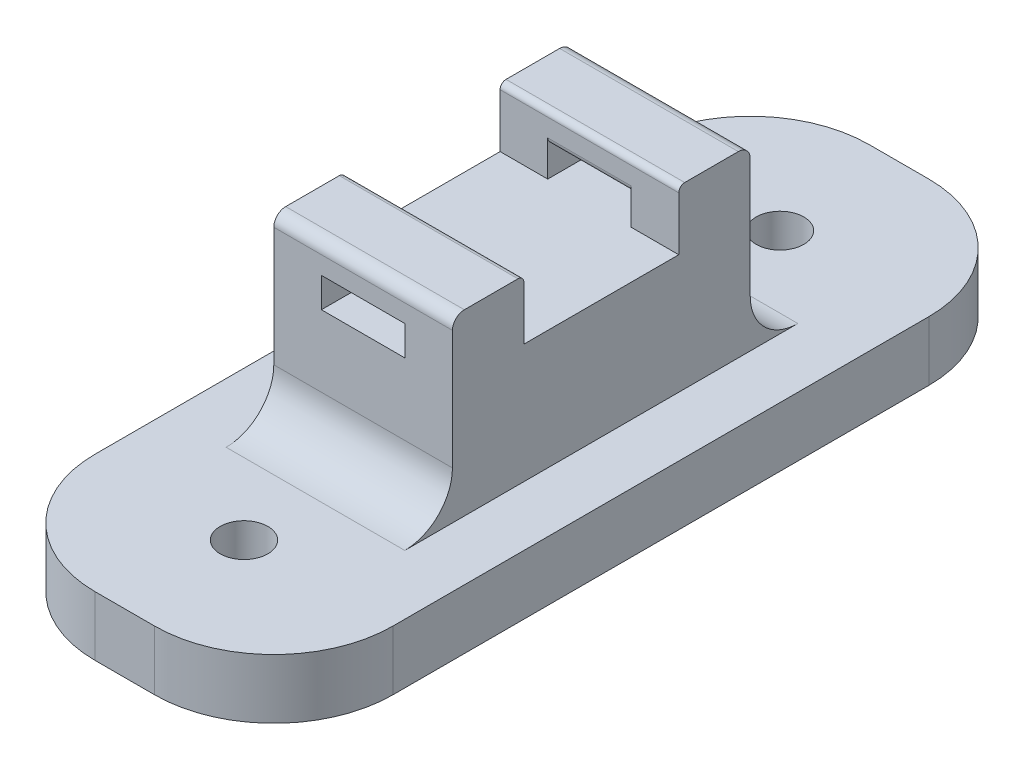
from build123d import *

# Parameters (mm, degrees)
SKETCH1_W           = 25
SKETCH1_H           = 65
BOSS_EXTRUDE1_DEPTH = 5
SKETCH2_R           = 2
CUT_EXTRUDE1_DEPTH  = 70.821200219
SKETCH3_W           = 15
SKETCH3_H           = 25
BOSS_EXTRUDE2_DEPTH = 10
SKETCH4_W           = 15
SKETCH4_H           = 6
BOSS_EXTRUDE3_DEPTH = 5
SKETCH5_W           = 7
SKETCH5_H           = 2.5
CUT_EXTRUDE2_DEPTH  = 56.226805086
FILLET1_R           = 0.5
FILLET2_R           = 0.5
FILLET3_R           = 1
FILLET4_R           = 10
FILLET5_R           = 4


with BuildPart() as part:
    # Sketch1 → Boss-Extrude1 (new body)
    with BuildSketch(Plane(origin=(0, 0, 0), x_dir=(1, 0, 0), z_dir=(0, 1, 0))):
        with Locations((12.5, 32.5)):
            Rectangle(SKETCH1_W, SKETCH1_H)
    extrude(amount=BOSS_EXTRUDE1_DEPTH)

    # Sketch2 → Cut-Extrude1 (cut, through all)
    with BuildSketch(Plane(origin=(0, 0, 0), x_dir=(1, 0, 0), z_dir=(0, 1, 0))):
        with Locations((12.5, 55)):
            Circle(SKETCH2_R)
        with Locations((12.5, 10)):
            Circle(SKETCH2_R)
    extrude(amount=CUT_EXTRUDE1_DEPTH, mode=Mode.SUBTRACT)

    # Sketch3 → Boss-Extrude2 (add)
    with BuildSketch(Plane(origin=(0, 5, 0), x_dir=(1, 0, 0), z_dir=(0, 1, 0))):
        with Locations((12.5, 32.5)):
            Rectangle(SKETCH3_W, SKETCH3_H)
    extrude(amount=BOSS_EXTRUDE2_DEPTH)

    # Sketch4 → Boss-Extrude3 (add)
    with BuildSketch(Plane(origin=(0, 15, 0), x_dir=(1, 0, 0), z_dir=(0, 1, 0))):
        with Locations((12.5, 42)):
            Rectangle(SKETCH4_W, SKETCH4_H)
        with Locations((12.5, 23)):
            Rectangle(SKETCH4_W, SKETCH4_H)
    extrude(amount=BOSS_EXTRUDE3_DEPTH)

    # Sketch5 → Cut-Extrude2 (cut, through all)
    with BuildSketch(Plane(origin=(0, 0, -45), x_dir=(-1, 0, 0), z_dir=(0, 0, -1))):
        with Locations((-12.5, 16.25)):
            Rectangle(SKETCH5_W, SKETCH5_H)
    extrude(amount=-CUT_EXTRUDE2_DEPTH, mode=Mode.SUBTRACT)

    # Fillet1
    fillet1_edges = [part.edges().sort_by_distance(p)[0] for p in [
        (12.5, 20, -39),
        (12.5, 17.5, -39),
    ]]
    fillet(fillet1_edges, radius=FILLET1_R)

    # Fillet2
    fillet2_edges = [part.edges().sort_by_distance(p)[0] for p in [
        (12.5, 20, -26),
        (12.5, 17.5, -26),
    ]]
    fillet(fillet2_edges, radius=FILLET2_R)

    # Fillet3
    fillet3_edges = [part.edges().sort_by_distance(p)[0] for p in [
        (12.5, 20, -20),
        (12.5, 20, -45),
    ]]
    fillet(fillet3_edges, radius=FILLET3_R)

    # Fillet4
    fillet4_edges = [part.edges().sort_by_distance(p)[0] for p in [
        (25, 2.5, 0),
        (0, 2.5, 0),
        (0, 2.5, -65),
        (25, 2.5, -65),
    ]]
    fillet(fillet4_edges, radius=FILLET4_R)

    # Fillet5
    fillet5_edges = [part.edges().sort_by_distance(p)[0] for p in [
        (12.5, 5, -45),
        (12.5, 5, -20),
    ]]
    fillet(fillet5_edges, radius=FILLET5_R)


solid = part.part
